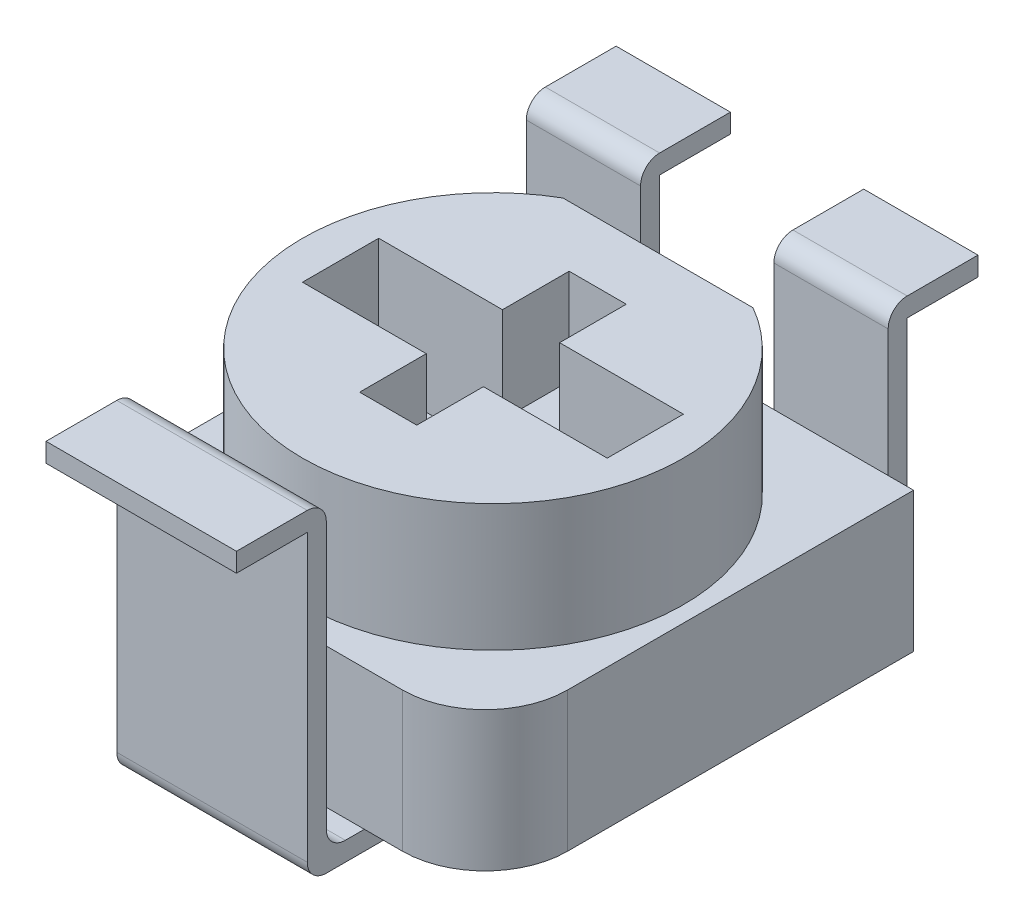
from build123d import *

# Parameters (mm, degrees)
BOSS_EXTRUDE1_DEPTH   = 2
SKETCH2_W             = 4.8
SKETCH2_H             = 1.2
CUT_EXTRUDE1_DEPTH    = 5.69041576
SKETCH3_W             = 0.9
SKETCH3_H             = 3.3
CUT_EXTRUDE2_DEPTH    = 1.5
BOSS_EXTRUDE2_DEPTH   = 2.2
SKETCH9_W             = 1.8
SKETCH9_H             = 3
BOSS_EXTRUDE6_DEPTH   = 0.3
BOSS_EXTRUDE6_2_DEPTH = 0.3
FILLET4_R             = 0.3
FILLET5_R             = 0.3
SKETCH10_W            = 1.8
SKETCH10_H            = 1.415
BOSS_EXTRUDE7_DEPTH   = 0.3
FILLET6_R             = 0.3
FILLET7_R             = 0.3
BOSS_EXTRUDE8_START   = -1.95
BOSS_EXTRUDE8_DEPTH   = 3
FILLET8_START         = -3
FILLET8_DEPTH         = 5
FILLET8_START_2       = -1.95
FILLET8_2_DEPTH       = 3


with BuildPart() as part:
    # Sketch1 → Boss-Extrude1 (new body)
    with BuildSketch(Plane(origin=(0, 0, 0), x_dir=(1, 0, 0), z_dir=(0, 1, 0))):
        with BuildLine():
            Line((-1.496662955, 2.6), (1.496662955, 2.6))
            ThreePointArc((1.496662955, 2.6), (0, -3), (-1.496662955, 2.6))
        make_face()
    extrude(amount=BOSS_EXTRUDE1_DEPTH)

    # Sketch2 → Cut-Extrude1 (cut, through all)
    with BuildSketch(Plane(origin=(0, 2, 0), x_dir=(1, 0, 0), z_dir=(0, 1, 0))):
        Rectangle(SKETCH2_W, SKETCH2_H)
    extrude(amount=-CUT_EXTRUDE1_DEPTH, mode=Mode.SUBTRACT)

    # Sketch3 → Cut-Extrude2 (cut)
    with BuildSketch(Plane(origin=(0, 2, 0), x_dir=(1, 0, 0), z_dir=(0, 1, 0))):
        Rectangle(SKETCH3_W, SKETCH3_H)
    extrude(amount=-CUT_EXTRUDE2_DEPTH, mode=Mode.SUBTRACT)



with BuildPart() as body_2:
    # Sketch4 → Boss-Extrude2 (new body)
    with BuildSketch(Plane.XZ):
        with BuildLine():
            Line((-3.25, -3.375), (3.25, -3.375))
            Line((3.25, -3.375), (3.25, 2.075))
            ThreePointArc((3.25, 2.075), (2.869238816, 2.994238816), (1.95, 3.375))
            Line((1.95, 3.375), (-1.95, 3.375))
            ThreePointArc((-1.95, 3.375), (-2.869238816, 2.994238816), (-3.25, 2.075))
            Line((-3.25, 2.075), (-3.25, -3.375))
        make_face()
    extrude(amount=BOSS_EXTRUDE2_DEPTH)


with BuildPart() as body_3:
    # Sketch9 → Boss-Extrude6 (new body)
    with BuildSketch(Plane(origin=(0, 0, -3.375), x_dir=(-1, 0, 0), z_dir=(0, 0, -1))):
        with Locations((-1.95, 0.5)):
            Rectangle(SKETCH9_W, SKETCH9_H)
    extrude(amount=BOSS_EXTRUDE6_DEPTH)

    # Fillet4
    fillet4_edges = [body_3.edges().sort_by_distance(p)[0] for p in [
        (1.95, -1, -3.675),
    ]]
    fillet(fillet4_edges, radius=FILLET4_R - 0.0001)  # a hair under: the kernel refuses the full size



with BuildPart() as body_4:
    # Sketch9 → Boss-Extrude6 2 (new body)
    with BuildSketch(Plane(origin=(0, 0, -3.375), x_dir=(-1, 0, 0), z_dir=(0, 0, -1))):
        with Locations((1.95, 0.5)):
            Rectangle(SKETCH9_W, SKETCH9_H)
    extrude(amount=BOSS_EXTRUDE6_2_DEPTH)

    # Fillet5
    fillet5_edges = [body_4.edges().sort_by_distance(p)[0] for p in [
        (-1.95, -1, -3.675),
    ]]
    fillet(fillet5_edges, radius=FILLET5_R - 0.0001)  # a hair under: the kernel refuses the full size


with BuildPart() as body_3_1:
    add(body_3.part)

    add(body_4.part)  # Boss-Extrude7 merges body 4
    # Sketch10 → Boss-Extrude7 (add)
    with BuildSketch(Plane(origin=(0, 2, 0), x_dir=(-1, 0, 0), z_dir=(0, 1, 0))):
        with Locations((1.95, -4.0825)):
            Rectangle(SKETCH10_W, SKETCH10_H)
        with Locations((-1.95, -4.0825)):
            Rectangle(SKETCH10_W, SKETCH10_H)
    extrude(amount=BOSS_EXTRUDE7_DEPTH)

    # Fillet6
    fillet6_edges = [body_3_1.edges().sort_by_distance(p)[0] for p in [
        (-1.95, 2.3, -3.375),
    ]]
    fillet(fillet6_edges, radius=FILLET6_R)

    # Fillet7
    fillet7_edges = [body_3_1.edges().sort_by_distance(p)[0] for p in [
        (1.95, 2.3, -3.375),
    ]]
    fillet(fillet7_edges, radius=FILLET7_R)


with BuildPart() as part_1:
    add(part.part)

    add(body_2.part)  # Boss-Extrude8 merges body 2
    # Sketch11 → Boss-Extrude8 (add)
    with BuildSketch(Plane(origin=(0, 0, 0), x_dir=(0, 0, -1), z_dir=(1, 0, 0)).offset(BOSS_EXTRUDE8_START)):
        with BuildLine():
            Line((-2.375, -2.2), (-2.375, -2.5))
            Line((-2.375, -2.5), (-3.675, -2.5))
            Line((-3.675, -2.5), (-3.675, 2))
            ThreePointArc((-3.675, 2), (-3.762867966, 2.212132034), (-3.975, 2.3))
            Line((-3.975, 2.3), (-5.09, 2.3))
            Line((-5.09, 2.3), (-5.09, 2))
            Line((-5.09, 2), (-3.975, 2))
            Line((-3.975, 2), (-3.975, -2.8))
            Line((-3.975, -2.8), (-2.075, -2.8))
            Line((-2.075, -2.8), (-2.075, -2.2))
            Line((-2.075, -2.2), (-2.375, -2.2))
        make_face()
    extrude(amount=BOSS_EXTRUDE8_DEPTH)

    # Fillet8: read off the stored shape, not the designer's step
    # Fillet8 outline → Fillet8 (cut)
    with BuildSketch(Plane.YZ.offset(FILLET8_START)):
        with BuildLine():
            Line((-2.8, 2.075), (-2.5, 2.075))
            ThreePointArc((-2.5, 2.075), (-2.712132034, 2.162867966), (-2.8, 2.375))
            Line((-2.8, 2.375), (-2.8, 2.075))
        make_face()
        with BuildLine():
            Line((-2.8, 3.975), (-2.8, 3.675))
            ThreePointArc((-2.8, 3.675), (-2.712132034, 3.887132034), (-2.5, 3.975))
            Line((-2.5, 3.975), (-2.8, 3.975))
        make_face()
    extrude(amount=FILLET8_DEPTH, mode=Mode.SUBTRACT)

    # Fillet8 2 outline → Fillet8 2 (add)
    with BuildSketch(Plane.YZ.offset(FILLET8_START_2)):
        with BuildLine():
            ThreePointArc((-2.2, 2.375), (-2.412132034, 2.462867966), (-2.5, 2.675))
            Line((-2.5, 2.675), (-2.5, 2.375))
            Line((-2.5, 2.375), (-2.2, 2.375))
        make_face()
        with BuildLine():
            ThreePointArc((-2.5, 3.375), (-2.412132034, 3.587132034), (-2.2, 3.675))
            Line((-2.2, 3.675), (-2.5, 3.675))
            Line((-2.5, 3.675), (-2.5, 3.375))
        make_face()
    extrude(amount=FILLET8_2_DEPTH)


solid = Compound([body_3_1.part, part_1.part])
